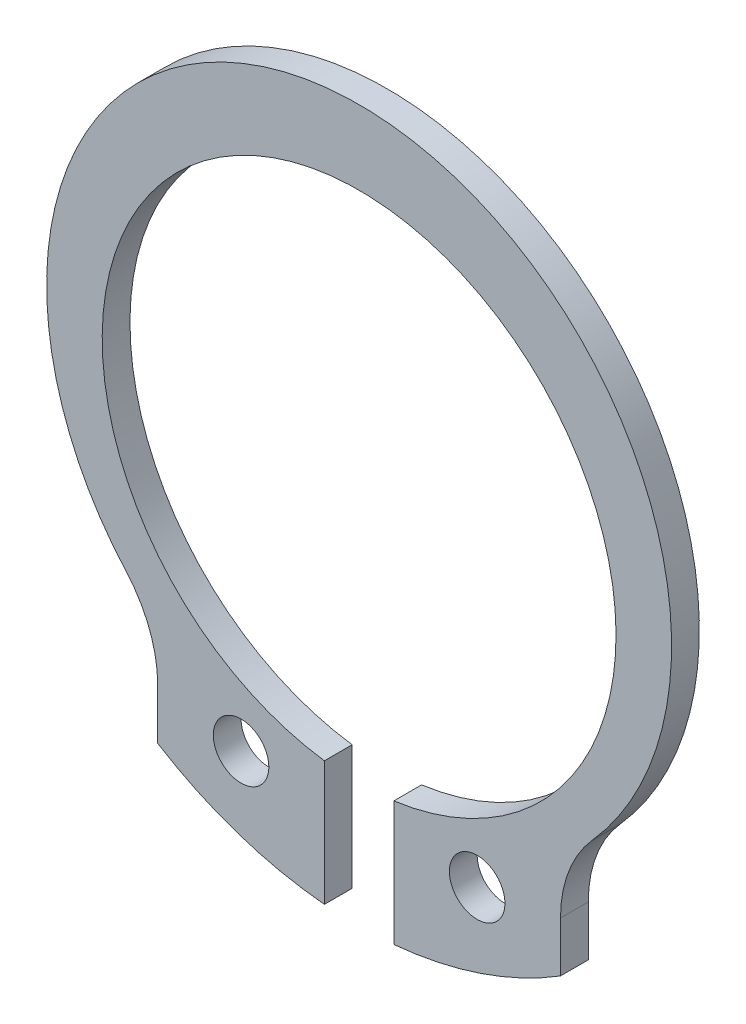
from build123d import *

# Parameters (mm, degrees)
SKETCH1_R  = 1
BODY_DEPTH = 1
FILLET1_R  = 4.5


with BuildPart() as part:
    # Sketch1 → Body (new body)
    with BuildSketch(Plane.XY):
        with BuildLine():
            Line((-1.25, -14.312855273), (-1.25, -9.83515139))
            ThreePointArc((-1.25, -9.83515139), (0, 8.58), (1.25, -9.83515139))
            Line((1.25, -9.83515139), (1.25, -14.312855273))
            ThreePointArc((1.25, -14.312855273), (4.368180929, -13.654952652), (7.25, -12.29443547))
            Line((7.25, -12.29443547), (7.25, -8.602325267))
            ThreePointArc((7.25, -8.602325267), (0, 11.25), (-7.25, -8.602325267))
            Line((-7.25, -8.602325267), (-7.25, -12.29443547))
            ThreePointArc((-7.25, -12.29443547), (-4.368180929, -13.654952652), (-1.25, -14.312855273))
        make_face()
        with Locations((-4.25, -11.032311518)):
            Circle(SKETCH1_R, mode=Mode.SUBTRACT)
        with Locations((4.25, -11.032311518)):
            Circle(SKETCH1_R, mode=Mode.SUBTRACT)
    extrude(amount=-BODY_DEPTH)

    # Fillet1
    fillet1_edges = [part.edges().sort_by_distance(p)[0] for p in [
        (-7.25, -8.602325267, -0.5),
        (7.25, -8.602325267, -0.5),
    ]]
    fillet(fillet1_edges, radius=FILLET1_R)


solid = part.part
